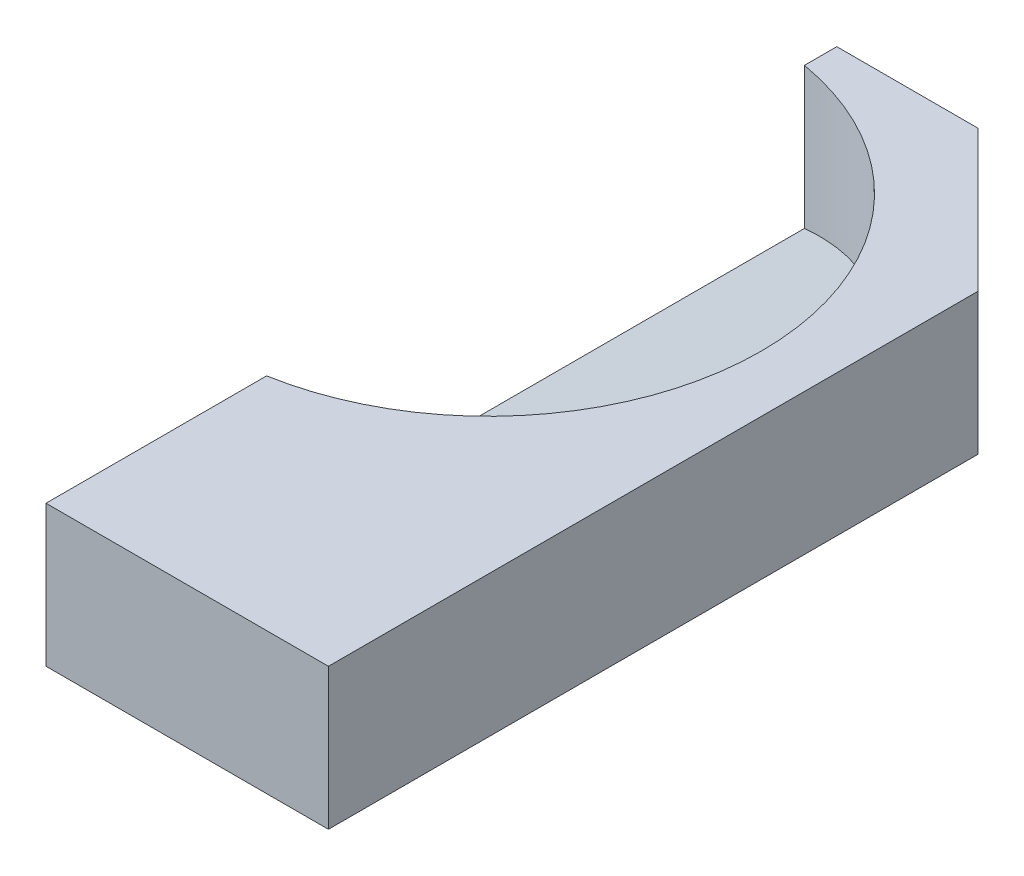
from build123d import *

# Parameters (mm, degrees)
ESQUISSE2_W             = 30
ESQUISSE2_H             = 84
BOSS_EXTRU_1_DEPTH      = 15
ESQUISSE3_R             = 29
ENL_V_MAT_EXTRU_1_DEPTH = 10
CHANFREIN1_SIZE         = 20
CHANFREIN1_SIZE_2       = 5
CHANFREIN2_SIZE         = 15


with BuildPart() as part:
    # Esquisse2 → Boss.-Extru.1 (new body)
    with BuildSketch(Plane(origin=(0, 0, 0), x_dir=(1, 0, 0), z_dir=(0, 1, 0))):
        with Locations((-17.412854797, -1.219560319)):
            Rectangle(ESQUISSE2_W, ESQUISSE2_H)
    extrude(amount=BOSS_EXTRU_1_DEPTH)

    # Esquisse3 → Enlèv. mat.-Extru.1 (cut)
    with BuildSketch(Plane(origin=(0, 15, 0), x_dir=(1, 0, 0), z_dir=(0, 1, 0))):
        with Locations((-37.412854797, 8.780439681)):
            Circle(ESQUISSE3_R)
    extrude(amount=-ENL_V_MAT_EXTRU_1_DEPTH, mode=Mode.SUBTRACT)

    # Chanfrein1
    # the kernel refuses this chamfer: 20, 5 mm, written as the material it takes off along each edge
    with BuildSketch(Plane(origin=(-32.412854797, 5, 71.727824028), x_dir=(0.9999563942249224, 0.00933861064031752, 0), z_dir=(0, 0, -1))) as chanfrein1_piece_1_section:
        Polygon((CHANFREIN1_SIZE * 0.999956394225, CHANFREIN1_SIZE * 0.00933861064032), (-CHANFREIN1_SIZE_2 * 0.00933861064032, CHANFREIN1_SIZE_2 * 0.999956394225), (0, 0), align=None)
    chanfrein1_piece_1 = extrude(amount=161.016527419, mode=Mode.PRIVATE)
    chanfrein1_piece_1 = chanfrein1_piece_1 & Plane(origin=(-37.412854797, 3.276810051, -8.780439681), x_dir=(1, 0, 0), z_dir=(0, 1, 0)) * Cylinder(29, 403, mode=Mode.PRIVATE)
    add(chanfrein1_piece_1, mode=Mode.SUBTRACT)

    # Chanfrein2
    chanfrein2_edges = [part.edges().sort_by_distance(p)[0] for p in [
        (-2.412854797, 7.5, -40.780439681),
    ]]
    chamfer(chanfrein2_edges, length=CHANFREIN2_SIZE)


solid = part.part
